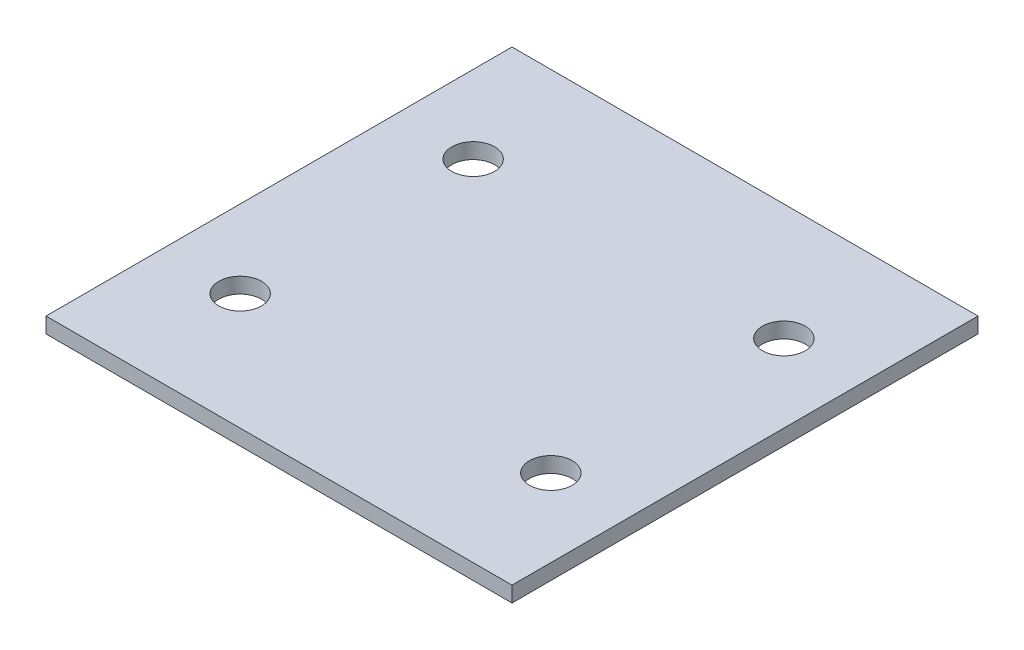
from build123d import *

# Parameters (mm, degrees)
SKETCH_1_W                   = 120
SKETCH_1_H                   = 120
SKETCH_1_R                   = 5.5
EXTRUDE_120_120_4_4_11_DEPTH = 4


with BuildPart() as part:
    # Эскиз1 → Пластина 120х120х4, 4 отв. Ø11 (new body)
    with BuildSketch(Plane(origin=(0, 0, 0), x_dir=(1, 0, 0), z_dir=(0, 1, 0))):
        Rectangle(SKETCH_1_W, SKETCH_1_H)
        with Locations((-40, -30)):
            Circle(SKETCH_1_R, mode=Mode.SUBTRACT)
        with Locations((-40, 30)):
            Circle(SKETCH_1_R, mode=Mode.SUBTRACT)
        with Locations((40, -30)):
            Circle(SKETCH_1_R, mode=Mode.SUBTRACT)
        with Locations((40, 30)):
            Circle(SKETCH_1_R, mode=Mode.SUBTRACT)
    extrude(amount=EXTRUDE_120_120_4_4_11_DEPTH)


solid = part.part
